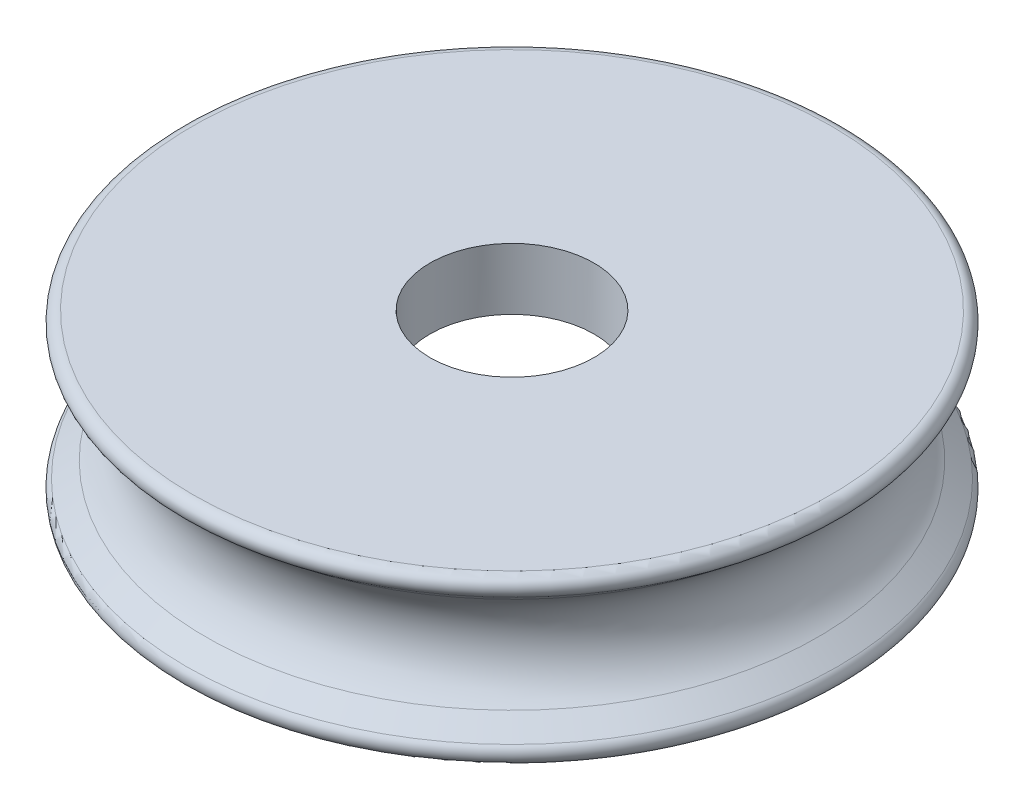
from build123d import *

# Parameters (mm, degrees)
SKETCH_1_R          = 17
EXTRUDE_1_DEPTH     = 8
SKETCH_2_R          = 12
CUT_EXTRUDE_2_DEPTH = 5
FILLET_1_R          = 0.5
SKETCH_5_R          = 4
CUT_EXTRUDE_3_DEPTH = 25.099505092


with BuildPart() as part:
    # Эскиз1 → Вытянуть1 (new body)
    with BuildSketch(Plane(origin=(0, 0, 0), x_dir=(1, 0, 0), z_dir=(0, 1, 0))):
        Circle(SKETCH_1_R)
    extrude(amount=EXTRUDE_1_DEPTH)

    # Эскиз2 → Вытянуть2 (cut)
    with BuildSketch(Plane.XZ):
        Circle(SKETCH_2_R)
    extrude(amount=-CUT_EXTRUDE_2_DEPTH, mode=Mode.SUBTRACT)

    # Эскиз4 → Вырез-Повернуть1 (revolve, cut)
    with BuildSketch(Plane(origin=(0, 0, 0), x_dir=(0, 0, -1), z_dir=(1, 0, 0))):
        with BuildLine():
            Line((17, 8), (14.928258035, 6.342606428))
            ThreePointArc((14.928258035, 6.342606428), (13.802343178, 4), (14.928258035, 1.657393572))
            Line((14.928258035, 1.657393572), (17, 0))
            Line((17, 0), (17, 8))
        make_face()
    revolve(axis=Axis((0, 11, 0), (0, 1, 0)), mode=Mode.SUBTRACT)

    # Скругление1
    fillet_1_edges = [part.edges().sort_by_distance(p)[0] for p in [
        (0, 8, 17),
        (0, 0, 17),
    ]]
    fillet(fillet_1_edges, radius=FILLET_1_R)

    # Эскиз5 → Вытянуть3 (cut, through all)
    with BuildSketch(Plane(origin=(0, 8, 0), x_dir=(1, 0, 0), z_dir=(0, 1, 0))):
        Circle(SKETCH_5_R)
    extrude(amount=-CUT_EXTRUDE_3_DEPTH, mode=Mode.SUBTRACT)


solid = part.part
